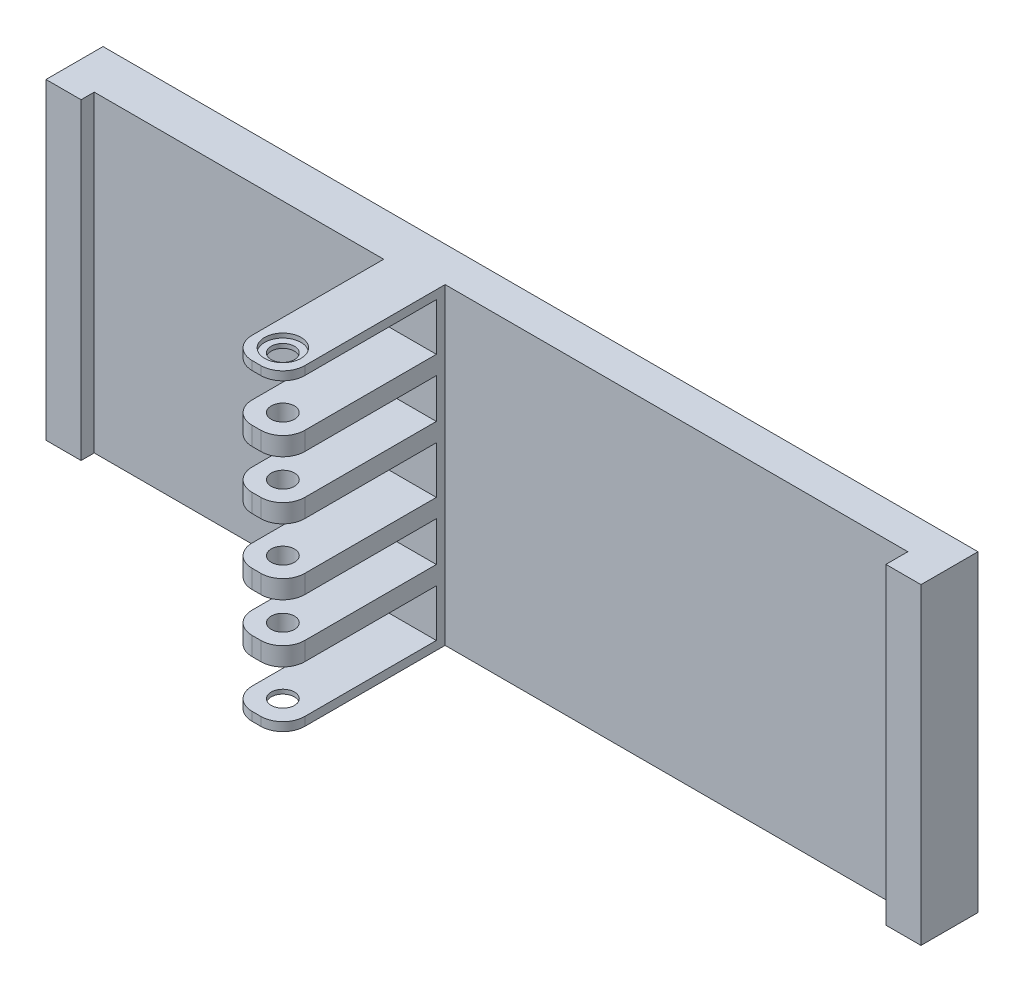
from build123d import *

# Parameters (mm, degrees)
SKETCH1_W            = 71.25
SKETCH1_H            = 12
BOSS_EXTRUDE1_DEPTH  = 10
SKETCH3_W            = 12
SKETCH3_H            = 1.975
SKETCH3_H_2          = 4.2
BOSS_EXTRUDE2_DEPTH  = 35
FILLET1_R            = 5
FILLET1_OF_MIRROR1_R = 5
SKETCH5_R            = 2.65
CUT_EXTRUDE1_DEPTH   = 86.120869944
SKETCH7_R            = 4.15
SKETCH7_R_2          = 2.65
CUT_EXTRUDE2_DEPTH   = 1
SKETCH8_W            = 74
SKETCH8_H            = 71.25
SKETCH8_W_2          = 113.5
BOSS_EXTRUDE3_DEPTH  = 8
SKETCH9_W            = 8
SKETCH9_H            = 71.25
BOSS_EXTRUDE4_DEPTH  = 5
BOSS_EXTRUDE5_REACH  = 153.168
SKETCH12_W           = 71.25
SKETCH12_H           = 2


with BuildPart() as part:
    # Sketch1 → Boss-Extrude1 (new body)
    with BuildSketch(Plane(origin=(0, 0, 0), x_dir=(0, 1, 0), z_dir=(0, 0, 1))):
        with Locations((-35.625, 6)):
            Rectangle(SKETCH1_W, SKETCH1_H)
    extrude(amount=BOSS_EXTRUDE1_DEPTH)

    # Sketch3 → Boss-Extrude2 (add)
    with BuildSketch(Plane.XY.offset(10)):
        with Locations((-6, -0.9875)):
            Rectangle(SKETCH3_W, SKETCH3_H)
        with Locations((-6, -14.875)):
            Rectangle(SKETCH3_W, SKETCH3_H_2)
        with Locations((-6, -28.125)):
            Rectangle(SKETCH3_W, SKETCH3_H_2)
    boss_extrude2 = extrude(amount=BOSS_EXTRUDE2_DEPTH)

    # Fillet1
    fillet1_edges = [part.edges().sort_by_distance(p)[0] for p in [
        (-12, -0.9875, 45),
        (0, -0.9875, 45),
        (-12, -14.875, 45),
        (0, -14.875, 45),
        (-12, -28.125, 45),
        (0, -28.125, 45),
    ]]
    fillet(fillet1_edges, radius=FILLET1_R)

    # Mirror1: Boss-Extrude2 across plane
    add(boss_extrude2.mirror(Plane.ZX.offset(-35.625)))

    # Fillet1 of Mirror1
    fillet1_of_mirror1_edges = [part.edges().sort_by_distance(p)[0] for p in [
        (-12, -70.2625, 45),
        (0, -70.2625, 45),
        (-12, -56.375, 45),
        (0, -56.375, 45),
        (-12, -43.125, 45),
        (0, -43.125, 45),
    ]]
    fillet(fillet1_of_mirror1_edges, radius=FILLET1_OF_MIRROR1_R)

    # Sketch5 → Cut-Extrude1 (cut, through all)
    with BuildSketch(Plane(origin=(0, 0, 0), x_dir=(-1, 0, 0), z_dir=(0, 1, 0))):
        with Locations((6, 39)):
            Circle(SKETCH5_R)
    extrude(amount=-CUT_EXTRUDE1_DEPTH, mode=Mode.SUBTRACT)

    # Sketch7 → Cut-Extrude2 (cut)
    with BuildSketch(Plane(origin=(0, 0, 0), x_dir=(-1, 0, 0), z_dir=(0, 1, 0))):
        with Locations((6, 39)):
            Circle(SKETCH7_R)
        with Locations((6, 39)):
            Circle(SKETCH7_R_2, mode=Mode.SUBTRACT)
    cut_extrude2 = extrude(amount=-CUT_EXTRUDE2_DEPTH, mode=Mode.SUBTRACT)

    # Mirror2: Cut-Extrude2 across plane
    add(cut_extrude2.mirror(Plane.ZX.offset(-35.625)), mode=Mode.SUBTRACT)

    # Sketch8 → Boss-Extrude3 (add)
    with BuildSketch(Plane(origin=(0, 0, 0), x_dir=(1, 0, 0), z_dir=(0, 0, -1))):
        with Locations((-49, 35.625)):
            Rectangle(SKETCH8_W, SKETCH8_H)
        with Locations((56.75, 35.625)):
            Rectangle(SKETCH8_W_2, SKETCH8_H)
    extrude(amount=-BOSS_EXTRUDE3_DEPTH)

    # Sketch9 → Boss-Extrude4 (add)
    with BuildSketch(Plane.XY.offset(8)):
        with Locations((109.5, -35.625)):
            Rectangle(SKETCH9_W, SKETCH9_H)
        with Locations((-82, -35.625)):
            Rectangle(SKETCH9_W, SKETCH9_H)
    extrude(amount=BOSS_EXTRUDE4_DEPTH)

    # Sketch12 → Boss-Extrude5 (add, up to next)
    with BuildSketch(Plane(origin=(-12, 0, 0), x_dir=(0, -1, 0), z_dir=(-1, 0, 0)), mode=Mode.PRIVATE) as boss_extrude5_sk1:
        with Locations((35.625, 9)):
            Rectangle(SKETCH12_W, SKETCH12_H)
    boss_extrude5_tool1 = extrude(boss_extrude5_sk1.sketch, amount=BOSS_EXTRUDE5_REACH, mode=Mode.PRIVATE) - part.part
    add(boss_extrude5_tool1.solids().sort_by_distance((-12, -35.625, 9))[0])


solid = part.part
